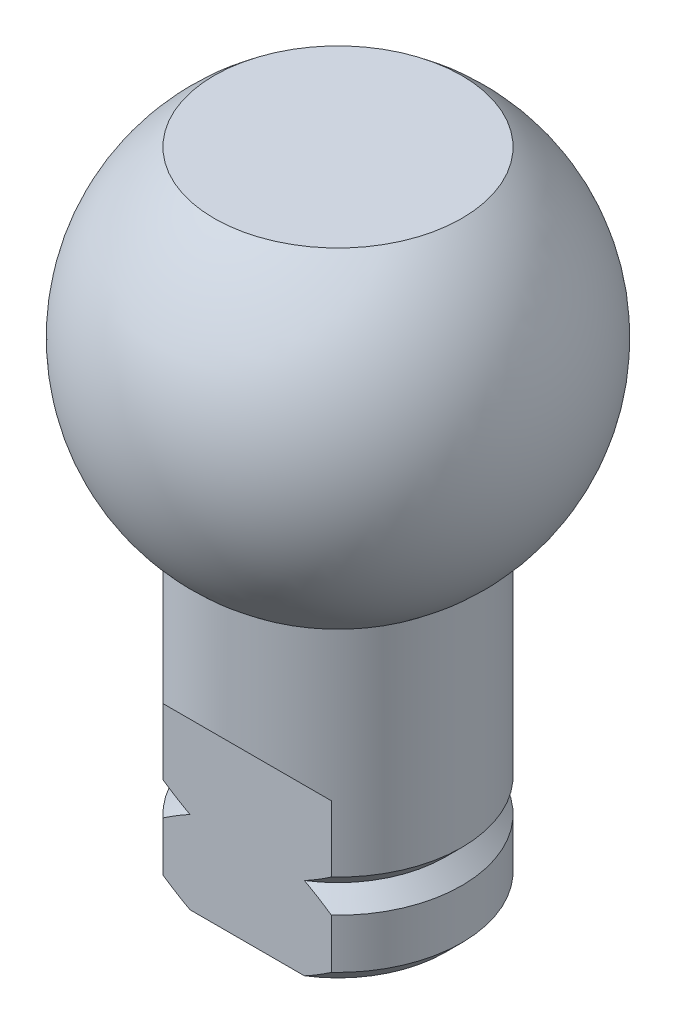
from build123d import *
from build123d.topology import SkipClean

# Parameters (mm, degrees)
SKETCH1_R           = 7.5
BOSS_EXTRUDE1_DEPTH = 20
CUT_EXTRUDE2_DEPTH  = 12
CUT_EXTRUDE4_DEPTH  = 1
CHAMFER1_SIZE       = 1
CHAMFER3_SIZE       = 2
CHAMFER4_SIZE       = 1


with BuildPart() as part:
    # Sketch1 → Boss-Extrude1 (new body)
    with BuildSketch(Plane(origin=(0, 0, 0), x_dir=(1, 0, 0), z_dir=(0, 1, 0))):
        with Locations(Location((0, 0, 0), (0, 0, 270))):
            Circle(SKETCH1_R)
    extrude(amount=BOSS_EXTRUDE1_DEPTH)

    # Sketch2 → Revolve1 (revolve)
    with BuildSketch(Plane.XY):
        with BuildLine():
            Line((7.5, 18.99999999999999), (7.5, 20))
            Line((7.5, 20), (0, 20))
            Line((0, 20), (3.1e-16, 39))
            Line((3.1e-16, 39), (7.500000000000009, 39))
            ThreePointArc((7.500000000000009, 39), (12.500000000000009, 28.999999999999993), (7.5, 18.99999999999999))
        make_face()
    revolve(axis=Axis((0, 20, 0), (2e-17, 1, 0)))

    # Sketch3 → Cut-Extrude2 (cut)
    with BuildSketch(Plane(origin=(0, 0, 0), x_dir=(-1, 0, 0), z_dir=(0, -1, 0))):
        with BuildLine():
            Line((-5.099019513592785, -5.5), (0, -5.5))
            Line((0, -5.5), (5.099019513592785, -5.5))
            ThreePointArc((5.099019513592785, -5.5), (-1.21e-15, -7.5), (-5.099019513592785, -5.5))
        make_face()
    extrude(amount=-CUT_EXTRUDE2_DEPTH, mode=Mode.SUBTRACT)

    # Sketch4 → Cut-Extrude4 (cut, symmetric)
    with SkipClean():  # the faces are left unmerged after this step: merging them gives an invalid solid
        with BuildSketch(Plane(origin=(0, 5, 0), x_dir=(1, 0, 0), z_dir=(0, 1, 0))):
            with BuildLine():
                Line((-1.381010726618471, -6.351598961912246), (-1.8059371040395404, -8.305937104039092))
                ThreePointArc((-1.8059371040395404, -8.305937104039092), (-8.451345022667464, 0.9081670043741211), (-2e-17, 8.5))
                ThreePointArc((-2e-17, 8.5), (8.451345022667484, 0.9081670043739513), (1.8059371040392067, -8.305937104039163))
                Line((1.8059371040392067, -8.305937104039163), (1.3810107266181975, -6.351598961912305))
                ThreePointArc((1.3810107266181975, -6.351598961912305), (6.462793252628076, 0.6944806504035996), (1.2e-16, 6.5))
                ThreePointArc((1.2e-16, 6.5), (-6.462793252628061, 0.6944806504037396), (-1.381010726618471, -6.351598961912246))
            make_face()
        extrude(amount=CUT_EXTRUDE4_DEPTH, both=True, mode=Mode.SUBTRACT)

    # Chamfer1
    chamfer1_edges = [part.edges().sort_by_distance(p)[0] for p in [
        (-6.2449979983983965, 6, -1.8027756377319957),
        (6.244997998398398, 4, -1.8027756377319937),
    ]]
    chamfer(chamfer1_edges, length=CHAMFER1_SIZE - 0.0001)  # a hair under: the kernel refuses the full size

    # Chamfer3
    chamfer3_edges = [part.edges().sort_by_distance(p)[0] for p in [
        (0, 12, 5.5),
    ]]
    chamfer(chamfer3_edges, length=CHAMFER3_SIZE - 0.0001)  # a hair under: the kernel refuses the full size

    # Chamfer4
    chamfer4_edges = [part.edges().sort_by_distance(p)[0] for p in [
        (2.3e-15, 0, -7.5),
    ]]
    chamfer(chamfer4_edges, length=CHAMFER4_SIZE)


solid = part.part
